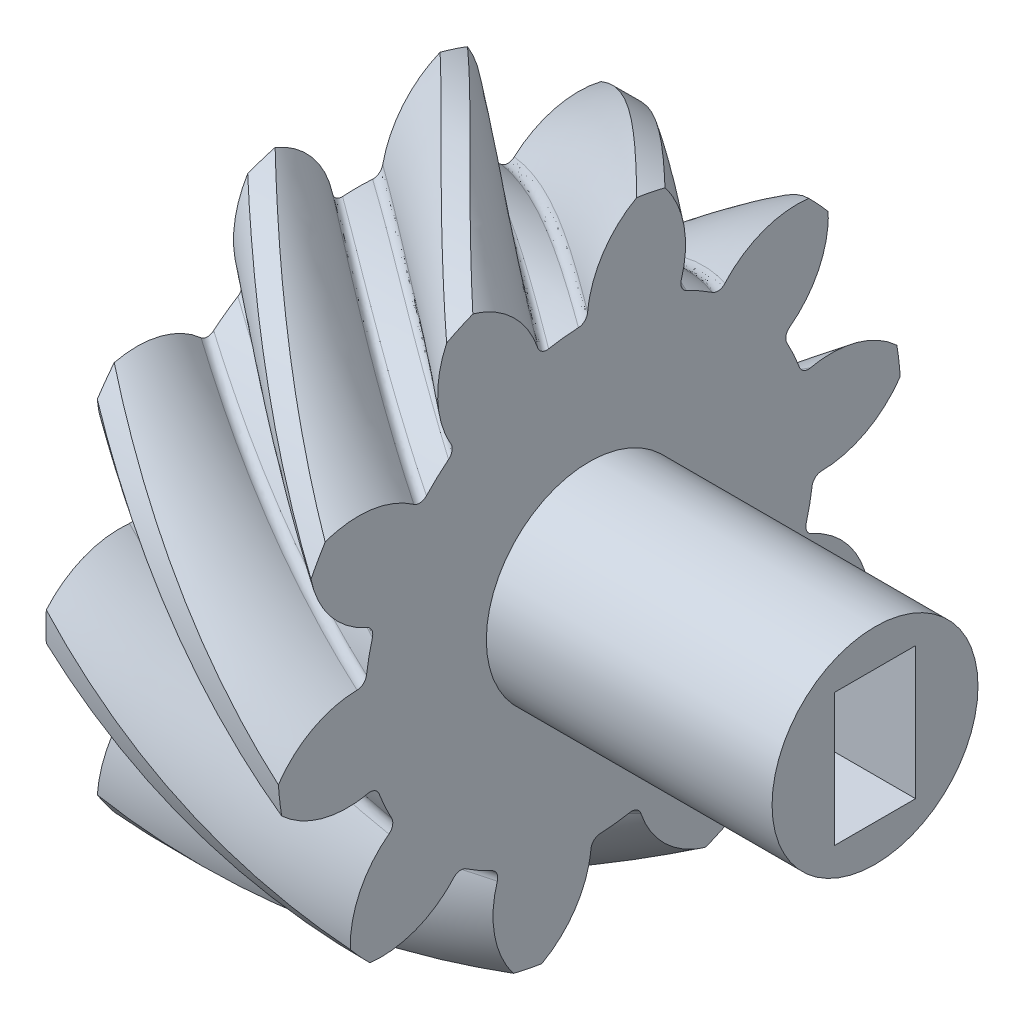
from build123d import *

# Parameters (mm, degrees)
BASPROSKE_W            = 9
BASPROSKE_H            = 12.106601718
TOOTHCUTRH_PITCH       = 76.068022033
TOOTHCUTRH_HEIGHT      = 9
TOOTHCUTRH_RADIUS      = 12.106601718
TOOTHCUTRH_START_ANGLE = -90
TEETHCUTSRH_COUNT      = 10
SKETCH4_R              = 4
BOSS_EXTRUDE1_DEPTH    = 11.1
BORSKE_W               = 3.15
BORSKE_H               = 5.15
BORE_DEPTH             = 62.5000025


with BuildPart() as part:
    # BasProSke → Base-Revolve (revolve)
    with BuildSketch(Plane(origin=(0, 0, 0), x_dir=(1, 0, 0), z_dir=(0, 1, 0)), mode=Mode.PRIVATE) as base_revolve_sk:
        with Locations((4.5, 6.053300859)):
            Rectangle(BASPROSKE_W, BASPROSKE_H)
    revolve(base_revolve_sk.sketch.rotate(Axis((-10, 0, 0), (1, 0, 0)), 180), axis=Axis((-10, 0, 0), (1, 0, 0)))

    # ToothCutRH: sweep along a helix
    with BuildLine() as toothcutrh_path:
        add(Helix(TOOTHCUTRH_PITCH, TOOTHCUTRH_HEIGHT, TOOTHCUTRH_RADIUS, center=(0, 0, 0), direction=(1, 0, 0), mode=Mode.PRIVATE).rotate(Axis((0, 0, 0), (1, 0, 0)), TOOTHCUTRH_START_ANGLE))
    # TooCutSkeRH → ToothCutRH (sweep, cut)
    with BuildSketch(Plane(origin=(0, 0, 0), x_dir=(0, 0, -1), z_dir=(1, 0, 0))):
        with BuildLine():
            ThreePointArc((0.58290801, 8.71212298), (0, 8.731601718), (-0.58290801, 8.71212298))
            ThreePointArc((-0.58290801, 8.71212298), (-0.834030884, 8.786800928), (-0.975417908, 9.007366571))
            ThreePointArc((-0.975417908, 9.007366571), (-1.980316234, 10.854176457), (-3.821198756, 11.869892432))
            ThreePointArc((-3.821198756, 11.869892432), (0, 12.469799769), (3.821198756, 11.869892432))
            ThreePointArc((3.821198756, 11.869892432), (1.980316234, 10.854176457), (0.975417908, 9.007366571))
            ThreePointArc((0.975417908, 9.007366571), (0.834030884, 8.786800928), (0.58290801, 8.71212298))
        make_face()
    toothcutrh = sweep(path=toothcutrh_path.line, is_frenet=True, mode=Mode.SUBTRACT)

    # TeethCutsRH: ToothCutRH ×10 about axis
    teethcutsrh_axis = Axis((-10, 0, 0), (1, 0, 0))
    for i in range(1, TEETHCUTSRH_COUNT):
        add(toothcutrh.rotate(teethcutsrh_axis, i * 360 / TEETHCUTSRH_COUNT), mode=Mode.SUBTRACT)

    # Sketch4 → Boss-Extrude1 (add)
    with BuildSketch(Plane(origin=(9, 0, 0), x_dir=(0, 0, -1), z_dir=(1, 0, 0))):
        with Locations(Location((0, 0, 0), (0, 0, 180))):
            Circle(SKETCH4_R)
    extrude(amount=BOSS_EXTRUDE1_DEPTH)

    # BorSke → Bore (cut, symmetric)
    with BuildSketch(Plane(origin=(0, 0, 0), x_dir=(0, 0, -1), z_dir=(1, 0, 0))):
        Rectangle(BORSKE_W, BORSKE_H)
    extrude(amount=BORE_DEPTH, both=True, mode=Mode.SUBTRACT)


solid = part.part
